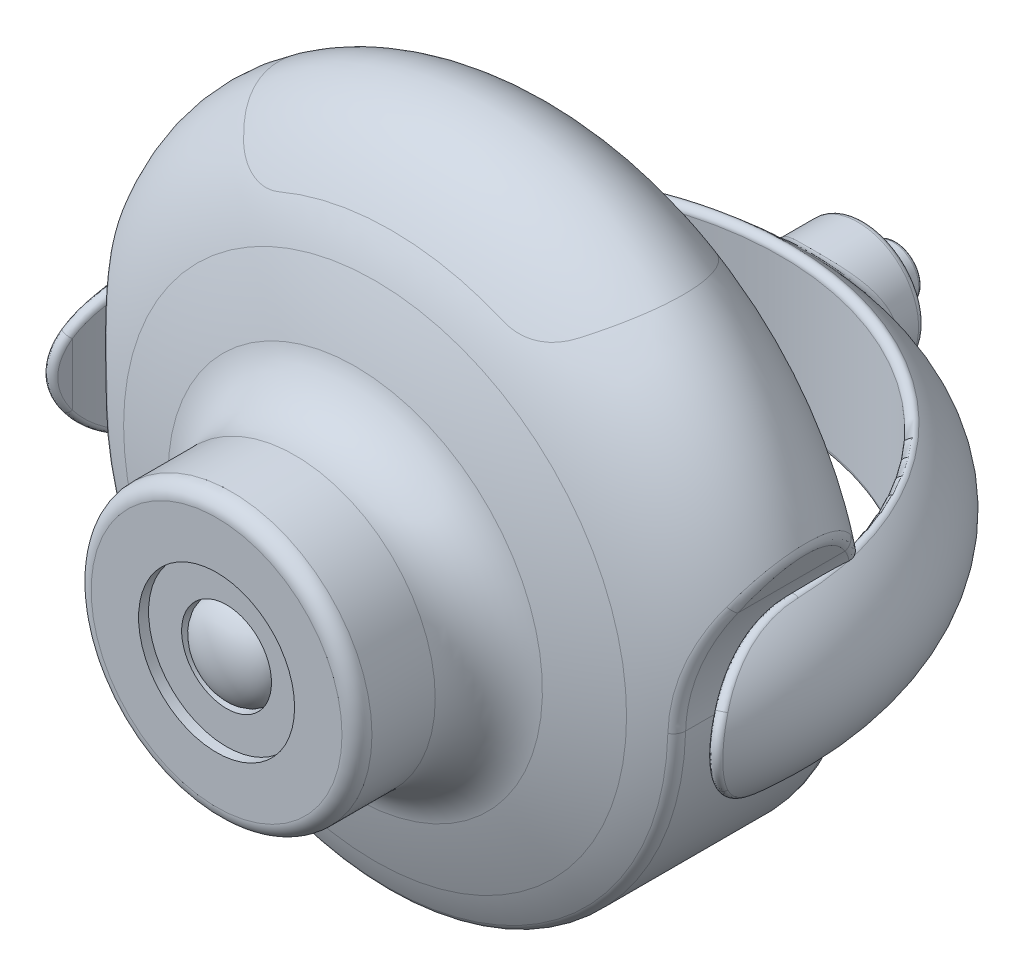
from build123d import *
from OCP.BRepAlgoAPI import BRepAlgoAPI_Cut
from OCP.TopTools import TopTools_ListOfShape

# Parameters (mm, degrees)
BOSS_EXTRUDE1_START      = 3
SKETCH3_R                = 11.25
BOSS_EXTRUDE1_DEPTH      = 30.2
SKETCH4_R                = 6.25
CUT_EXTRUDE1_DEPTH       = 0.8
SKETCH5_R                = 3.6
CUT_EXTRUDE2_DEPTH       = 1
FILLET1_R                = 5
FILLET2_R                = 1.2
SPLIT1_SURFACE_1_1_BACK  = 87.342
SPLIT1_SURFACE_1_1_DEPTH = 174.684
SPLIT1_SURFACE_1_2_BACK  = 87.342
SPLIT1_SURFACE_1_2_DEPTH = 174.684
SPLIT1_SURFACE_2_3_BACK  = 87.342
SPLIT1_SURFACE_2_3_DEPTH = 174.684
SPLIT1_SURFACE_2_4_BACK  = 87.342
SPLIT1_SURFACE_2_4_DEPTH = 174.684
MOVE_START               = 4
MOVE_FACE1_DEPTH         = 16
BOSS_EXTRUDE2_START      = -25
SKETCH7_R                = 4.85
BOSS_EXTRUDE2_DEPTH      = 5.7
SKETCH8_R                = 2.075
BOSS_EXTRUDE3_DEPTH      = 2.54
FILLET3_R                = 1
FILLET4_R                = 0.5
FILLET5_R                = 0.25
BOSS_EXTRUDE4_START      = 20
SKETCH9_R                = 2.3
BOSS_EXTRUDE4_DEPTH      = 5
FILLET6_R                = 0.5
FILLET7_R                = 1
SKETCH10_R               = 0.7
CUT_EXTRUDE3_DEPTH       = 3
BODY_MOVE_COPY1_ANGLE    = 90


with BuildPart() as part:
    # Sketch2 → Revolve1 (revolve)
    with BuildSketch(Plane(origin=(0, 0, 0), x_dir=(0, 0, -1), z_dir=(1, 0, 0)), mode=Mode.PRIVATE) as revolve1_sk:
        with BuildLine():
            Line((0, 0), (-24, 0))
            ThreePointArc((-24, 0), (-23.118497873, 10.22585571), (-20.5, 20.15))
            add(Edge.make_bspline(
                [(-20.5, 20.15), (-12, 43.879643743), (-3.5, 20.15)],
                knots=[0, 0, 0, 1, 1, 1], degree=2, weights=[1, 0.508593846, 1]))
            ThreePointArc((-3.5, 20.15), (-0.881502127, 10.22585571), (0, 0))
        make_face()
    revolve(revolve1_sk.sketch.rotate(Axis((0, 0, 0), (0, 0, 1)), 180), axis=Axis((0, 0, 0), (0, 0, 1)))

    # Sketch3 → Boss-Extrude1 (add)
    with BuildSketch(Plane.XY.offset(BOSS_EXTRUDE1_START)):
        with Locations(Location((0, 0, 0), (0, 0, 90))):
            Circle(SKETCH3_R)
    extrude(amount=BOSS_EXTRUDE1_DEPTH)

    # Sketch4 → Cut-Extrude1 (cut)
    with BuildSketch(Plane.XY.offset(33.2)):
        Circle(SKETCH4_R)
    extrude(amount=-CUT_EXTRUDE1_DEPTH, mode=Mode.SUBTRACT)

    # Sketch5 → Cut-Extrude2 (cut)
    with BuildSketch(Plane.XY.offset(32.4)):
        Circle(SKETCH5_R)
    extrude(amount=-CUT_EXTRUDE2_DEPTH, mode=Mode.SUBTRACT)

    # Dome1: read off the stored shape, not the designer's step
    # Dome1 outline → Dome1 (revolve)
    with BuildSketch(Plane.XZ):
        with BuildLine():
            add(Edge.make_bspline(
                [(0, 33.4), (3.6, 33.4), (3.6, 31.4)],
                knots=[4.71238898, 4.71238898, 4.71238898, 6.283185307, 6.283185307, 6.283185307], degree=2, weights=[1, 0.707106781, 1]))
            Line((0, 33.4), (0, 31.4))
            Line((0, 31.4), (3.6, 31.4))
        make_face()
    revolve(axis=Axis((0, 0, 0), (0, 0, 1)))

    # Fillet1
    fillet1_edges = [part.edges().sort_by_distance(p)[0] for p in [
        (-11.249999999, 0, 22.931401394),
    ]]
    fillet(fillet1_edges, radius=FILLET1_R)

    # Fillet2
    fillet2_edges = [part.edges().sort_by_distance(p)[0] for p in [
        (0, -11.25, 33.2),
    ]]
    fillet(fillet2_edges, radius=FILLET2_R)


with BuildPart() as body_2:
    # Split1: the piece behind the surface
    add(part.part)
    # Split1 surface 1: a surface, the sketch's curves swept straight by 174.684 mm
    with BuildLine(Plane.XY.offset(-SPLIT1_SURFACE_1_1_BACK), mode=Mode.PRIVATE) as split1_surface_1_1_path:
        Line((19.124148757, 24.709396082), (13.456521739, 21.437190098))
        ThreePointArc((13.456521739, 21.437190098), (11.260210313, 20.776548313), (9, 21.166010489))
        ThreePointArc((9, 21.166010489), (0, 23), (-9, 21.166010489))
        ThreePointArc((-9, 21.166010489), (-11.260210313, 20.776548313), (-13.456521739, 21.437190098))
        Line((-13.456521739, 21.437190098), (-19.124148757, 24.709396082))
    split1_surface_1_1 = Shell.extrude(split1_surface_1_1_path.wire(), (0 * SPLIT1_SURFACE_1_1_DEPTH, 0 * SPLIT1_SURFACE_1_1_DEPTH, 1 * SPLIT1_SURFACE_1_1_DEPTH))
    split(bisect_by=split1_surface_1_1, keep=Keep.BOTTOM)


with BuildPart() as part_1:
    add(part.part)

    # Split1: split by a surface, the side it looks to stays
    # Split1 surface 1: a surface, the sketch's curves swept straight by 174.684 mm
    with BuildLine(Plane.XY.offset(-SPLIT1_SURFACE_1_2_BACK), mode=Mode.PRIVATE) as split1_surface_1_2_path:
        Line((19.124148757, 24.709396082), (13.456521739, 21.437190098))
        ThreePointArc((13.456521739, 21.437190098), (11.260210313, 20.776548313), (9, 21.166010489))
        ThreePointArc((9, 21.166010489), (0, 23), (-9, 21.166010489))
        ThreePointArc((-9, 21.166010489), (-11.260210313, 20.776548313), (-13.456521739, 21.437190098))
        Line((-13.456521739, 21.437190098), (-19.124148757, 24.709396082))
    split1_surface_1_2 = Shell.extrude(split1_surface_1_2_path.wire(), (0 * SPLIT1_SURFACE_1_2_DEPTH, 0 * SPLIT1_SURFACE_1_2_DEPTH, 1 * SPLIT1_SURFACE_1_2_DEPTH))
    split(bisect_by=split1_surface_1_2, keep=Keep.TOP)


with BuildPart() as body_3:
    # Split1 2: the piece behind the surface
    add(part_1.part)
    # Split1 surface 2: a surface, the sketch's curves swept straight by 174.684 mm
    with BuildLine(Plane.XY.offset(-SPLIT1_SURFACE_2_3_BACK), mode=Mode.PRIVATE) as split1_surface_2_3_path:
        Line((-28.784003096, 15.825212044), (-24.861278667, 7.412902359))
        ThreePointArc((-24.861278667, 7.412902359), (-23.515265771, 3.525035846), (-22.993278869, -0.555991771))
        ThreePointArc((-22.993278869, -0.555991771), (0, -23), (22.993278869, -0.555991771))
        ThreePointArc((22.993278869, -0.555991771), (23.515265771, 3.525035846), (24.861278667, 7.412902359))
        Line((24.861278667, 7.412902359), (28.784003096, 15.825212044))
    split1_surface_2_3 = Shell.extrude(split1_surface_2_3_path.wire(), (0 * SPLIT1_SURFACE_2_3_DEPTH, 0 * SPLIT1_SURFACE_2_3_DEPTH, 1 * SPLIT1_SURFACE_2_3_DEPTH))
    split(bisect_by=split1_surface_2_3, keep=Keep.BOTTOM)


with BuildPart() as part_2:
    add(part_1.part)

    # Split1 2: split by a surface, the side it looks to stays
    # Split1 surface 2: a surface, the sketch's curves swept straight by 174.684 mm
    with BuildLine(Plane.XY.offset(-SPLIT1_SURFACE_2_4_BACK), mode=Mode.PRIVATE) as split1_surface_2_4_path:
        Line((-28.784003096, 15.825212044), (-24.861278667, 7.412902359))
        ThreePointArc((-24.861278667, 7.412902359), (-23.515265771, 3.525035846), (-22.993278869, -0.555991771))
        ThreePointArc((-22.993278869, -0.555991771), (0, -23), (22.993278869, -0.555991771))
        ThreePointArc((22.993278869, -0.555991771), (23.515265771, 3.525035846), (24.861278667, 7.412902359))
        Line((24.861278667, 7.412902359), (28.784003096, 15.825212044))
    split1_surface_2_4 = Shell.extrude(split1_surface_2_4_path.wire(), (0 * SPLIT1_SURFACE_2_4_DEPTH, 0 * SPLIT1_SURFACE_2_4_DEPTH, 1 * SPLIT1_SURFACE_2_4_DEPTH))
    split(bisect_by=split1_surface_2_4, keep=Keep.TOP)

    # Fillet7
    fillet7_edges = [part_2.edges().sort_by_distance(p)[0] for p in [
        (26.202341134, 10.288820101, 12),
        (23.554987066, 3.691286655, 5.310358008),
        (23.554987068, 3.691286654, 18.689641992),
        (16.065680651, -16.458854928, 4.795261405),
        (16.065680651, -16.458854928, 19.204738595),
        (-23.554987069, 3.691286653, 5.310358009),
        (-23.304870634, 2.509717807, 18.945409206),
        (-26.202341134, 10.288820101, 12),
    ]]
    fillet(fillet7_edges, radius=FILLET7_R)


with BuildPart() as move_face1_tool:
    # Move Face1: read off the stored shape, not the designer's step
    # Move Face1 outline → Move Face1 (new body)
    with BuildSketch(Plane.XY.offset(MOVE_START)):
        with BuildLine():
            Line((-26.686013894, 8.959858099), (-25.767586454, 6.990284097))
            ThreePointArc((-25.767586454, 6.990284097), (-24.488874203, 3.29681091), (-23.992986646, -0.580165326))
            ThreePointArc((-23.992986646, -0.580165326), (0, -24), (23.992986646, -0.580165326))
            ThreePointArc((23.992986646, -0.580165326), (24.488874203, 3.29681091), (25.767586454, 6.990284097))
            Line((25.767586454, 6.990284097), (26.686013877, 8.959858063))
            Line((26.686013877, 8.959858063), (28, 11.777710399))
            Line((28, 11.777710399), (28, 12))
            Line((28, 12), (27.000277425, 12))
            Line((27.000277425, 12), (26.202340915, 10.288819632))
            Line((26.202340915, 10.288819632), (24.861278667, 7.412902359))
            ThreePointArc((24.861278667, 7.412902359), (23.515265771, 3.525035846), (22.993278869, -0.555991771))
            ThreePointArc((22.993278869, -0.555991771), (0, -23), (-22.993278869, -0.555991771))
            ThreePointArc((-22.993278869, -0.555991771), (-23.515265771, 3.525035846), (-24.861278667, 7.412902359))
            Line((-24.861278667, 7.412902359), (-26.202340867, 10.288819527))
            Line((-26.202340867, 10.288819527), (-27.000277426, 12))
            Line((-27.000277426, 12), (-28, 12))
            Line((-28, 12), (-28, 11.777710398))
            Line((-28, 11.777710398), (-26.686013894, 8.959858099))
        make_face()
    extrude(amount=MOVE_FACE1_DEPTH)


with BuildPart() as body_3_1:
    add(body_3.part)

    # Move Face1: cut by move_face1_tool, with a tolerance
    move_face1_stock = TopTools_ListOfShape()
    move_face1_stock.Append(body_3_1.part.wrapped)
    move_face1_tools = TopTools_ListOfShape()
    move_face1_tools.Append(move_face1_tool.part.wrapped)
    move_face1_cut = BRepAlgoAPI_Cut()
    move_face1_cut.SetArguments(move_face1_stock)
    move_face1_cut.SetTools(move_face1_tools)
    move_face1_cut.SetFuzzyValue(0.00001)
    move_face1_cut.Build()
    add(Compound.cast(move_face1_cut.Shape()).solids(), mode=Mode.REPLACE)

    # Sketch7 → Boss-Extrude2 (add)
    with BuildSketch(Plane(origin=(0, 0, 0), x_dir=(1, 0, 0), z_dir=(0, 1, 0)).offset(BOSS_EXTRUDE2_START)):
        with Locations(Location((0, -12, 0), (0, 0, 270))):
            Circle(SKETCH7_R)
    extrude(amount=-BOSS_EXTRUDE2_DEPTH)

    # Sketch8 → Boss-Extrude3 (add)
    with BuildSketch(Plane.XZ.offset(30.7)):
        with Locations(Location((0, 12, 0), (0, 0, 270))):
            Circle(SKETCH8_R)
    extrude(amount=BOSS_EXTRUDE3_DEPTH)

    # Fillet3
    fillet3_edges = [body_3_1.edges().sort_by_distance(p)[0] for p in [
        (4.85, -27.729046143, 12),
    ]]
    fillet(fillet3_edges, radius=FILLET3_R)

    # Fillet4
    fillet4_edges = [body_3_1.edges().sort_by_distance(p)[0] for p in [
        (0, -30.7, 7.15),
    ]]
    fillet(fillet4_edges, radius=FILLET4_R)

    # Fillet5
    fillet5_edges = [body_3_1.edges().sort_by_distance(p)[0] for p in [
        (0, -33.24, 14.075),
    ]]
    fillet(fillet5_edges, radius=FILLET5_R)

    # Sketch9 → Boss-Extrude4 (add)
    with BuildSketch(Plane(origin=(0, 0, 0), x_dir=(0, 0, -1), z_dir=(1, 0, 0)).offset(BOSS_EXTRUDE4_START)):
        with Locations(Location((-12, 0, 0), (0, 0, 194.61044659))):
            Circle(SKETCH9_R)
    boss_extrude4 = extrude(amount=BOSS_EXTRUDE4_DEPTH)

    # Mirror1: Boss-Extrude4 across plane
    add(boss_extrude4.mirror(Plane(origin=(0, 0, 0), x_dir=(0, 0, 1), z_dir=(1, 0, 0))))

    # Fillet6
    fillet6_edges = [body_3_1.edges().sort_by_distance(p)[0] for p in [
        (-26.416236973, 8.381319624, 9.730481845),
        (-24.541606985, 3.515913131, 18.004774465),
        (-24.541606993, 3.515913138, 5.995225504),
        (-16.764188501, -17.174457311, 18.584455483),
        (16.764188501, -17.174457311, 5.415544517),
        (24.541606993, 3.515913138, 18.004774496),
        (24.541606985, 3.515913133, 5.995225528),
        (26.416231697, 8.38130831, 14.269539848),
    ]]
    fillet(fillet6_edges, radius=FILLET6_R)

    # Sketch10 → Cut-Extrude3 (cut)
    with BuildSketch(Plane.XZ.offset(33.24)):
        with Locations(Location((0, 12, 0), (0, 0, 270))):
            Circle(SKETCH10_R)
    extrude(amount=-CUT_EXTRUDE3_DEPTH, mode=Mode.SUBTRACT)


with BuildPart() as body_3_2:
    # Body-Move/Copy1: moved
    add(body_3_1.part.rotate(Axis((0, 0, 12), (1, 0, 0)), BODY_MOVE_COPY1_ANGLE))


solid = Compound([body_2.part, part_2.part, body_3_2.part])
